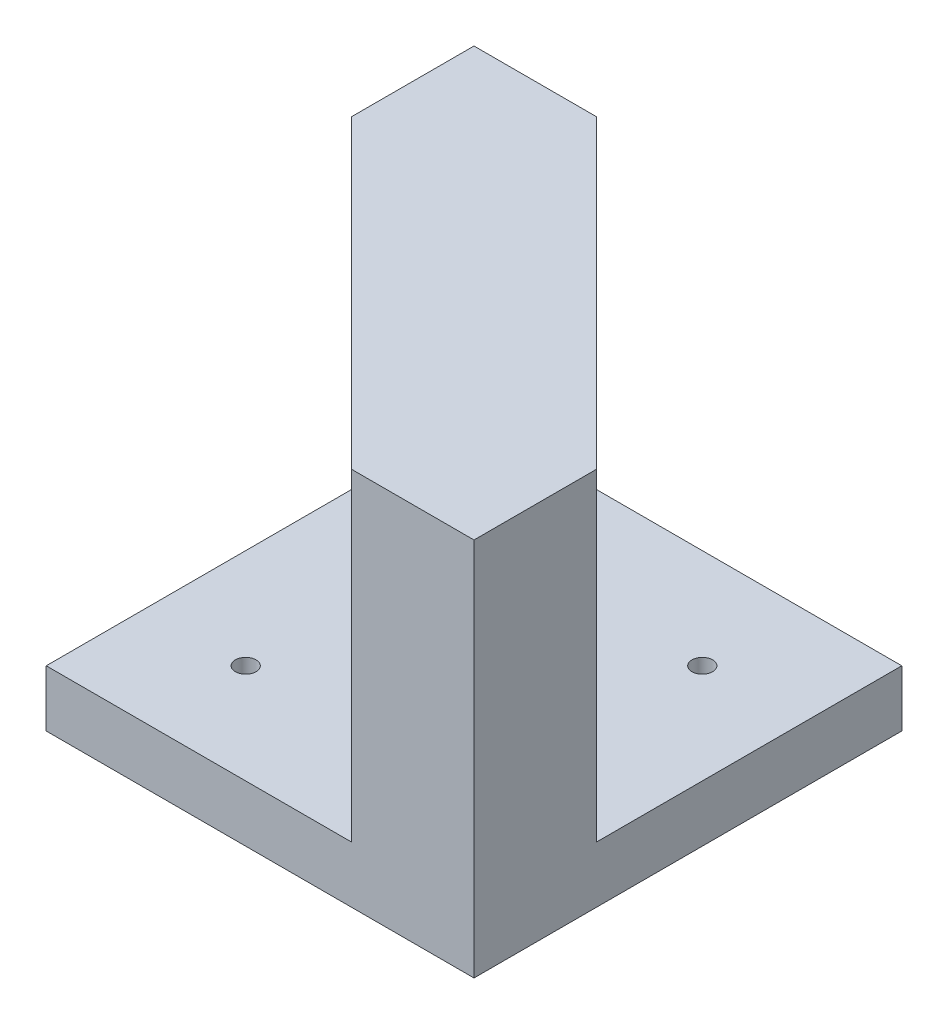
from build123d import *

# Parameters (mm, degrees)
SKETCH1_W           = 67.31
SKETCH1_H           = 67.31
SKETCH1_R           = 1.625
BOSS_EXTRUDE1_DEPTH = 8.89
BOSS_EXTRUDE2_DEPTH = 50.8
SKETCH3_R           = 2
CUT_EXTRUDE2_DEPTH  = 127


with BuildPart() as part:
    # Sketch1 → Boss-Extrude1 (new body)
    with BuildSketch(Plane(origin=(0, 0, 0), x_dir=(1, 0, 0), z_dir=(0, 1, 0))):
        Rectangle(SKETCH1_W, SKETCH1_H)
        with Locations((17.960512242, 17.960512242)):
            Circle(SKETCH1_R, mode=Mode.SUBTRACT)
        with Locations((-17.960512242, -17.960512242)):
            Circle(SKETCH1_R, mode=Mode.SUBTRACT)
    extrude(amount=BOSS_EXTRUDE1_DEPTH)

    # Sketch2 → Boss-Extrude2 (add)
    with BuildSketch(Plane(origin=(0, 8.89, 0), x_dir=(1, 0, 0), z_dir=(0, 1, 0))):
        Polygon((-14.350984867, 33.655), (-33.655, 33.655), (-33.655, 14.350984867), (14.350984867, -33.655), (33.655, -33.655), (33.655, -14.350984867), align=None)
    extrude(amount=BOSS_EXTRUDE2_DEPTH)

    # Sketch3 → Cut-Extrude2 (cut)
    with BuildSketch(Plane(origin=(-9.652007567, 0, 9.652007567), x_dir=(0.7071067811865464, 0, 0.7071067811865488), z_dir=(-0.7071067811865488, 0, 0.7071067811865464))):
        with Locations((-17.960512242, 52.250512242)):
            Circle(SKETCH3_R)
        with Locations((17.960512242, 16.329487758)):
            Circle(SKETCH3_R)
        with Locations((0, 34.29)):
            Circle(SKETCH3_R)
        with Locations((17.960512242, 52.250512242)):
            Circle(SKETCH3_R)
        with Locations((-17.960512242, 16.329487758)):
            Circle(SKETCH3_R)
    extrude(amount=-CUT_EXTRUDE2_DEPTH, mode=Mode.SUBTRACT)


solid = part.part
